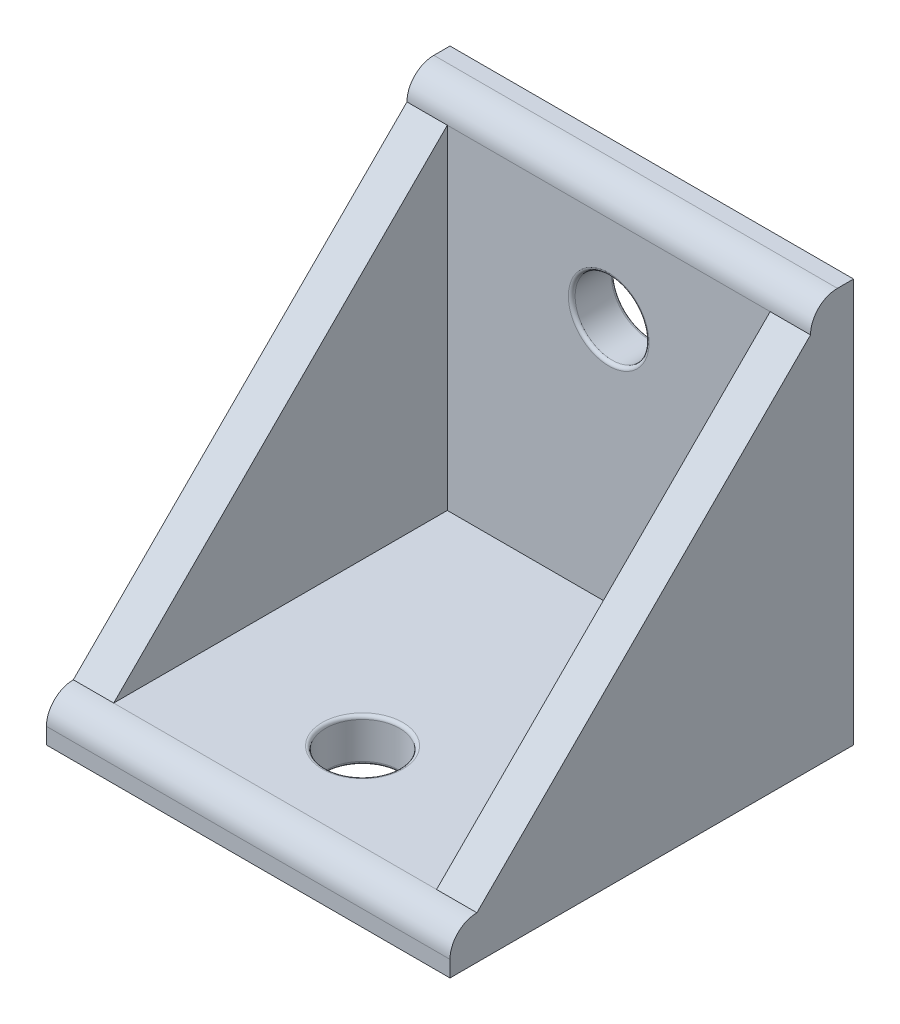
from build123d import *

# Parameters (mm, degrees)
SKETCH1_W           = 30
SKETCH1_H           = 30
BOSS_EXTRUDE1_DEPTH = 3.2
SKETCH2_W           = 30
SKETCH2_H           = 3.2
BOSS_EXTRUDE2_DEPTH = 26.8
SKETCH3_R           = 2.75
CUT_EXTRUDE1_DEPTH  = 35.179526035
SKETCH4_R           = 2.75
CUT_EXTRUDE2_DEPTH  = 43.932971013
FILLET1_R           = 2
FILLET2_R           = 0.25
BOSS_EXTRUDE3_DEPTH = 3


with BuildPart() as part:
    # Sketch1 → Boss-Extrude1 (new body)
    with BuildSketch(Plane(origin=(0, 0, 0), x_dir=(1, 0, 0), z_dir=(0, 1, 0))):
        Rectangle(SKETCH1_W, SKETCH1_H)
    extrude(amount=BOSS_EXTRUDE1_DEPTH)

    # Sketch2 → Boss-Extrude2 (add)
    with BuildSketch(Plane(origin=(0, 3.2, 0), x_dir=(1, 0, 0), z_dir=(0, 1, 0))):
        with Locations((0, 13.4)):
            Rectangle(SKETCH2_W, SKETCH2_H)
    extrude(amount=BOSS_EXTRUDE2_DEPTH)

    # Sketch3 → Cut-Extrude1 (cut, through all)
    with BuildSketch(Plane(origin=(0, 3.2, 0), x_dir=(1, 0, 0), z_dir=(0, 1, 0))):
        with Locations((0, -6.5)):
            Circle(SKETCH3_R)
    extrude(amount=-CUT_EXTRUDE1_DEPTH, mode=Mode.SUBTRACT)

    # Sketch4 → Cut-Extrude2 (cut, through all)
    with BuildSketch(Plane.XY.offset(-11.8)):
        with Locations((0, 21.5)):
            Circle(SKETCH4_R)
    extrude(amount=-CUT_EXTRUDE2_DEPTH, mode=Mode.SUBTRACT)

    # Fillet1
    fillet1_edges = [part.edges().sort_by_distance(p)[0] for p in [
        (0, 30, -11.8),
        (0, 3.2, 15),
    ]]
    fillet(fillet1_edges, radius=FILLET1_R)

    # Fillet2
    fillet2_edges = [part.edges().sort_by_distance(p)[0] for p in [
        (-2.75, 21.5, -11.8),
        (-2.75, 21.5, -15),
        (-2.75, 3.2, 6.5),
        (-2.75, 0, 6.5),
    ]]
    fillet(fillet2_edges, radius=FILLET2_R)

    # Sketch7 → Boss-Extrude3 (add)
    with BuildSketch(Plane(origin=(15, 0, 0), x_dir=(0, 0, -1), z_dir=(1, 0, 0))):
        Polygon((11.8, 3.2), (11.8, 28), (-13, 3.2), align=None)
    boss_extrude3 = extrude(amount=-BOSS_EXTRUDE3_DEPTH)

    # Mirror1: Boss-Extrude3 across plane
    add(boss_extrude3.mirror(Plane(origin=(0, 0, 0), x_dir=(0, 0, 1), z_dir=(1, 0, 0))))


solid = part.part
